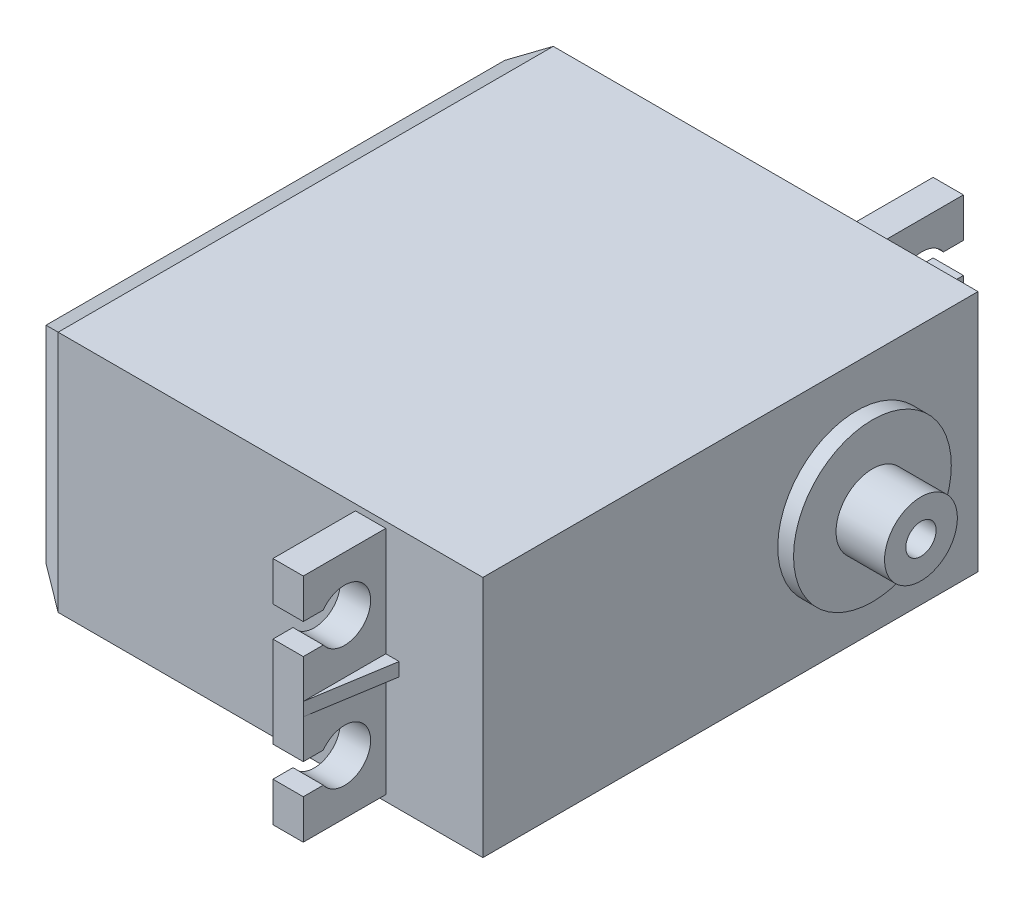
from build123d import *
from OCP.BRepFilletAPI import BRepFilletAPI_MakeChamfer

# Parameters (mm, degrees)
SKIZZE1_W                           = 37.5
SKIZZE1_H                           = 20
AUFSATZ_LINEAR_AUSTRAGEN1_DEPTH     = 40.8
SKIZZE2_W                           = 2.5
SKIZZE2_H                           = 19
AUFSATZ_LINEAR_AUSTRAGEN2_DEPTH     = 6.8
F_4_3_4_3_DIAMETER_HOLE2_AT_2_COUNT = 2
F_4_3_4_3_DIAMETER_HOLE2_AT_2_PITCH = 10
CUT_EXTRUDE1_REACH                  = 58.886
SKETCH1_W                           = 3
SKETCH1_H                           = 2.5
BOSS_EXTRUDE1_DEPTH                 = 0.55
SKIZZE5_R                           = 6.5
AUFSATZ_LINEAR_AUSTRAGEN3_DEPTH     = 1.3
SKIZZE6_R                           = 3
AUFSATZ_LINEAR_AUSTRAGEN4_DEPTH     = 4
SKIZZE7_W                           = 4
SKIZZE7_H                           = 6
AUFSATZ_LINEAR_AUSTRAGEN5_DEPTH     = 1.5
SKIZZE8_W                           = 2.7
SKIZZE8_H                           = 5
SKIZZE8_W_2                         = 1.7
SKIZZE8_H_2                         = 4
AUFSATZ_LINEAR_AUSTRAGEN6_DEPTH     = 5
F_5_0_5_DIAMETER_HOLE1_D            = 5
F_5_0_5_DIAMETER_HOLE1_DEPTH        = 3.5
F_5_0_5_DIAMETER_HOLE1_TIP          = 1.502151548
M3_GEWINDEBOHRUNG1_D                = 2.5
M3_GEWINDEBOHRUNG1_DEPTH            = 8.5
M3_GEWINDEBOHRUNG1_TIP              = 0.751075774
CHAMFER1_SIZE                       = 1.5
CHAMFER1_SIZE_2                     = 2.5


with BuildPart() as part:
    # Skizze1 → Aufsatz-Linear austragen1 (new body)
    with BuildSketch(Plane.XY):
        Rectangle(SKIZZE1_W, SKIZZE1_H)
    extrude(amount=AUFSATZ_LINEAR_AUSTRAGEN1_DEPTH)

    # Skizze2 → Aufsatz-Linear austragen2 (add)
    with BuildSketch(Plane.XY.offset(40.8)):
        with Locations((9.5, 0)):
            Rectangle(SKIZZE2_W, SKIZZE2_H)
    aufsatz_linear_austragen2 = extrude(amount=AUFSATZ_LINEAR_AUSTRAGEN2_DEPTH)

    # Skizze3 → Ø4.3 (4.3) Diameter Hole2 (revolve, cut)
    with BuildSketch(Plane(origin=(10.75, 5, 44.2), x_dir=(0, 0, -1), z_dir=(0, 1, 0))):
        Polygon((0, 0), (0, 11.291850331), (2.15, 10), (2.15, 0), align=None)
    f_4_3_4_3_diameter_hole2 = revolve(axis=Axis((17.1, 5, 44.2), (-1, 0, 0)), mode=Mode.SUBTRACT)

    # Ø4.3 (4.3) Diameter Hole2 at 2: Ø4.3 (4.3) Diameter Hole2 ×2
    with Locations(*[(0, -i * F_4_3_4_3_DIAMETER_HOLE2_AT_2_PITCH, 0) for i in range(1, F_4_3_4_3_DIAMETER_HOLE2_AT_2_COUNT)]):
        add(f_4_3_4_3_diameter_hole2, mode=Mode.SUBTRACT)

    # Sketch1 → Cut-Extrude1 (cut, up to next)
    with BuildSketch(Plane(origin=(10.75, 0, 0), x_dir=(0, 0, -1), z_dir=(1, 0, 0)), mode=Mode.PRIVATE) as cut_extrude1_sk1:
        with Locations((-47.05, 5)):
            Rectangle(SKETCH1_W, SKETCH1_H)
    cut_extrude1_tool1 = extrude(cut_extrude1_sk1.sketch, amount=-CUT_EXTRUDE1_REACH, mode=Mode.PRIVATE) & part.part
    # Sketch1 → Cut-Extrude1 (cut, up to next)
    with BuildSketch(Plane(origin=(10.75, 0, 0), x_dir=(0, 0, -1), z_dir=(1, 0, 0)), mode=Mode.PRIVATE) as cut_extrude1_sk2:
        with Locations((-47.05, -5)):
            Rectangle(SKETCH1_W, SKETCH1_H)
    cut_extrude1_tool2 = extrude(cut_extrude1_sk2.sketch, amount=-CUT_EXTRUDE1_REACH, mode=Mode.PRIVATE) & part.part
    cut_extrude1_1 = cut_extrude1_tool1.solids().sort_by_distance((10.75, 5, 47.05))[0]
    add(cut_extrude1_1, mode=Mode.SUBTRACT)
    cut_extrude1_2 = cut_extrude1_tool2.solids().sort_by_distance((10.75, -5, 47.05))[0]
    add(cut_extrude1_2, mode=Mode.SUBTRACT)
    cut_extrude1 = cut_extrude1_1 + cut_extrude1_2  # Cut-Extrude1 as one shape, for the pattern or mirror that repeats it

    # Spiegeln2: Aufsatz-Linear austragen2, Ø4.3 (4.3) Diameter Hole2, Cut-Extrude1 across plane
    add(aufsatz_linear_austragen2.mirror(Plane(origin=(0, 0, 20.4), x_dir=(1, 0, 0), z_dir=(0, 0, -1))))
    add(f_4_3_4_3_diameter_hole2.mirror(Plane(origin=(0, 0, 20.4), x_dir=(1, 0, 0), z_dir=(0, 0, -1))), mode=Mode.SUBTRACT)
    add(cut_extrude1.mirror(Plane(origin=(0, 0, 20.4), x_dir=(1, 0, 0), z_dir=(0, 0, -1))), mode=Mode.SUBTRACT)

    # Spiegeln2 copy 1 sketch → Spiegeln2 copy 1 (revolve, cut)
    with BuildSketch(Plane(origin=(10.75, -5, -3.4), x_dir=(0, 0, 1), z_dir=(0, 1, 0))):
        Polygon((0, 0), (0, -11.291850331), (2.15, -10), (2.15, 0), align=None)
    revolve(axis=Axis((17.1, -5, -3.4), (1, 0, 0)), mode=Mode.SUBTRACT)

    # Sketch3 → Boss-Extrude1 (add, symmetric)
    with BuildSketch(Plane(origin=(0, 0, 0), x_dir=(1, 0, 0), z_dir=(0, 1, 0))):
        Polygon((10.75, 0), (11.85, 0), (10.75, 6.8), align=None)
    boss_extrude1 = extrude(amount=BOSS_EXTRUDE1_DEPTH, both=True)

    # Skizze5 → Aufsatz-Linear austragen3 (add)
    with BuildSketch(Plane(origin=(18.75, 0, 0), x_dir=(0, 0, -1), z_dir=(1, 0, 0))):
        with Locations(Location((-10, 0, 0), (0, 0, 270))):
            Circle(SKIZZE5_R)
    extrude(amount=AUFSATZ_LINEAR_AUSTRAGEN3_DEPTH)

    # Skizze6 → Aufsatz-Linear austragen4 (add)
    with BuildSketch(Plane(origin=(20.05, 0, 0), x_dir=(0, 0, -1), z_dir=(1, 0, 0))):
        with Locations(Location((-10, 0, 0), (0, 0, 90))):
            Circle(SKIZZE6_R)
    extrude(amount=AUFSATZ_LINEAR_AUSTRAGEN4_DEPTH)

    # Skizze7 → Aufsatz-Linear austragen5 (add)
    with BuildSketch(Plane(origin=(0, 0, 0), x_dir=(-1, 0, 0), z_dir=(0, 0, -1))):
        with Locations((14.25, 0)):
            Rectangle(SKIZZE7_W, SKIZZE7_H)
    extrude(amount=AUFSATZ_LINEAR_AUSTRAGEN5_DEPTH)

    # Skizze8 → Aufsatz-Linear austragen6 (add)
    with BuildSketch(Plane(origin=(0, 0, -1.5), x_dir=(-1, 0, 0), z_dir=(0, 0, -1))):
        with Locations((14.25, 0)):
            Rectangle(SKIZZE8_W, SKIZZE8_H)
        with Locations((14.25, 0)):
            Rectangle(SKIZZE8_W_2, SKIZZE8_H_2, mode=Mode.SUBTRACT)
    extrude(amount=AUFSATZ_LINEAR_AUSTRAGEN6_DEPTH)

    # Ø5.0 (5) Diameter Hole1
    with Locations(Plane(origin=(0, 0, 0), x_dir=(-1, 0, 0), z_dir=(0, 0, -1))):
        with Locations((4.25, 0)):
            Hole(F_5_0_5_DIAMETER_HOLE1_D / 2, depth=F_5_0_5_DIAMETER_HOLE1_DEPTH)
            with Locations((0, 0, -(F_5_0_5_DIAMETER_HOLE1_DEPTH + F_5_0_5_DIAMETER_HOLE1_TIP / 2))):  # 118° drill point
                Cone(0, F_5_0_5_DIAMETER_HOLE1_D / 2, F_5_0_5_DIAMETER_HOLE1_TIP, mode=Mode.SUBTRACT)

    # M3 Gewindebohrung1
    with Locations(Plane(origin=(24.05, 0, 0), x_dir=(0, 0, -1), z_dir=(1, 0, 0))):
        with Locations((-10, 0)):
            Hole(M3_GEWINDEBOHRUNG1_D / 2, depth=M3_GEWINDEBOHRUNG1_DEPTH)
            with Locations((0, 0, -(M3_GEWINDEBOHRUNG1_DEPTH + M3_GEWINDEBOHRUNG1_TIP / 2))):  # 118° drill point
                Cone(0, M3_GEWINDEBOHRUNG1_D / 2, M3_GEWINDEBOHRUNG1_TIP, mode=Mode.SUBTRACT)

    # Mirror1: Boss-Extrude1 across plane
    add(boss_extrude1.mirror(Plane(origin=(0, 0, 20.4), x_dir=(1, 0, 0), z_dir=(0, 0, -1))))

    # Chamfer1
    chamfer1_edges_1 = [part.edges().sort_by_distance(p)[0] for p in [
        (-18.75, 0, 40.8),
    ]]
    chamfer1_side_1 = [part.faces().sort_by_distance(p)[0] for p in [
        (-18.75, 0, 40.77),
    ]]
    chamfer1_edges_2 = [part.edges().sort_by_distance(p)[0] for p in [
        (-18.75, 0, 0),
    ]]
    chamfer1_side_2 = [part.faces().sort_by_distance(p)[0] for p in [
        (-18.75, 0, 0.03),
    ]]
    chamfer1_edges_3 = [part.edges().sort_by_distance(p)[0] for p in [
        (-18.75, 10, 20.4),
    ]]
    chamfer1_side_3 = [part.faces().sort_by_distance(p)[0] for p in [
        (-18.72, 10, 20.4),
    ]]
    chamfer1_edges_4 = [part.edges().sort_by_distance(p)[0] for p in [
        (-18.75, -10, 20.4),
    ]]
    chamfer1_side_4 = [part.faces().sort_by_distance(p)[0] for p in [
        (-18.75, -9.97, 20.4),
    ]]
    chamfer1 = BRepFilletAPI_MakeChamfer(part.part.solid().wrapped)
    for e in chamfer1_edges_1:
        chamfer1.Add(CHAMFER1_SIZE - 0.0001, CHAMFER1_SIZE_2 - 0.0001, e.wrapped, chamfer1_side_1[0].wrapped)
    for e in chamfer1_edges_2:
        chamfer1.Add(CHAMFER1_SIZE - 0.0001, CHAMFER1_SIZE_2 - 0.0001, e.wrapped, chamfer1_side_2[0].wrapped)
    for e in chamfer1_edges_3:
        chamfer1.Add(CHAMFER1_SIZE_2 - 0.0001, CHAMFER1_SIZE - 0.0001, e.wrapped, chamfer1_side_3[0].wrapped)
    for e in chamfer1_edges_4:
        chamfer1.Add(CHAMFER1_SIZE - 0.0001, CHAMFER1_SIZE_2 - 0.0001, e.wrapped, chamfer1_side_4[0].wrapped)
    add(Compound.cast(chamfer1.Shape()), mode=Mode.REPLACE)  # a hair under: the kernel refuses the full size


solid = part.part
